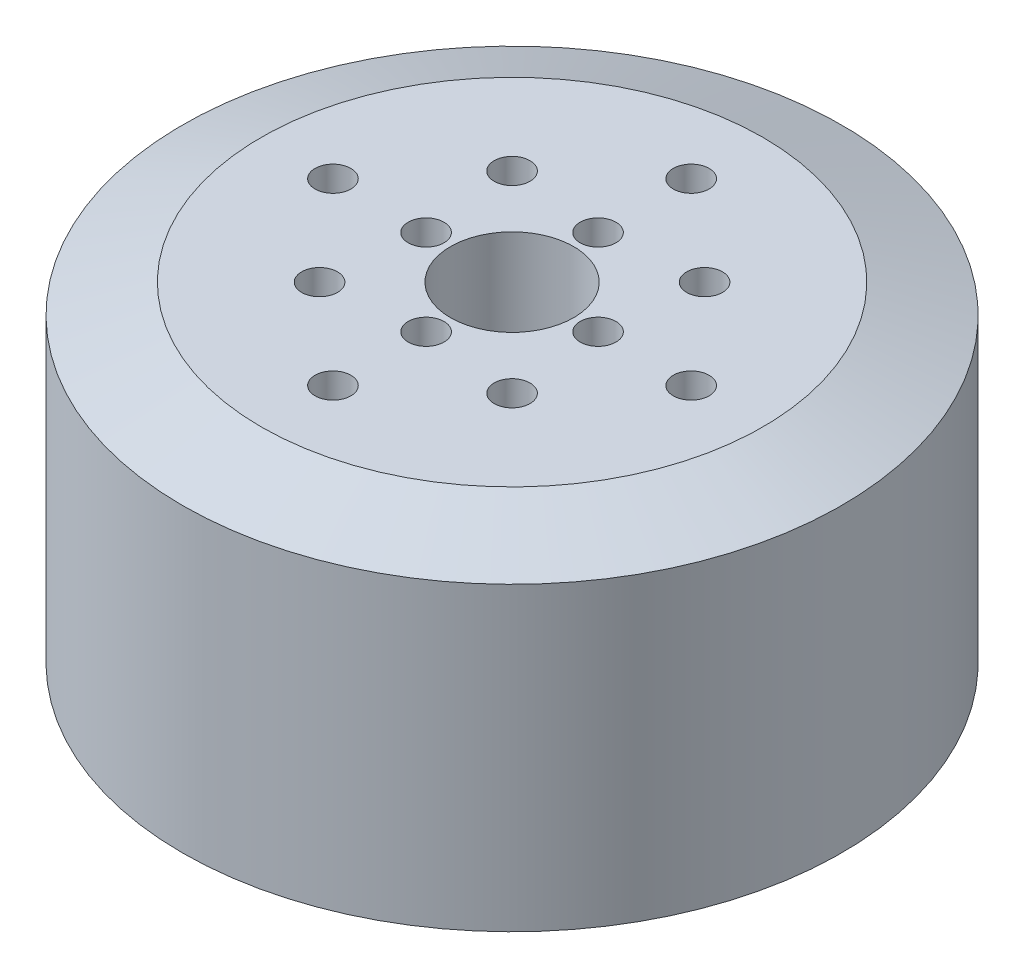
from build123d import *

# Parameters (mm, degrees)
SKETCH_1_R          = 23
EXTRUDE_1_DEPTH     = 23
CHAMFER_1_SIZE      = 2
CHAMFER_1_SIZE2     = 5.494954839
SKETCH_2_R          = 3.5
CUT_EXTRUDE_1_DEPTH = 40.837168574
SKETCH_2_3_R        = 5
SKETCH_2_3_R_2      = 3.5
EXTRUDE_2_DEPTH     = 32
CUT_EXTRUDE_START   = -19
SKETCH_4_R          = 21
SKETCH_4_R_2        = 5
CUT_EXTRUDE_2_DEPTH = 19
M3X0_51_D           = 2.5
M3X0_52_D           = 2.5
M3X0_52_DEPTH       = 7.5
M3X0_52_TIP         = 0.751075774
M3X0_53_D           = 2.5
SKETCH_12_R         = 4.3
CUT_EXTRUDE_3_DEPTH = 25


with BuildPart() as part:
    # Эскиз1 → Бобышка-Вытянуть1 (new body)
    with BuildSketch(Plane(origin=(0, 0, 0), x_dir=(1, 0, 0), z_dir=(0, 1, 0))):
        Circle(SKETCH_1_R)
    extrude(amount=EXTRUDE_1_DEPTH)

    # Фаска1
    chamfer_1_edges = [part.edges().sort_by_distance(p)[0] for p in [
        (-23, 23, 0),
    ]]
    chamfer_1_side = [part.faces().sort_by_distance(p)[0] for p in [
        (-23, 11.5, 0),
    ]]
    chamfer(chamfer_1_edges, length=CHAMFER_1_SIZE, length2=CHAMFER_1_SIZE2, reference=chamfer_1_side[0])

    # Эскиз2 → Вырез-Вытянуть1 (cut, through all)
    with BuildSketch(Plane(origin=(0, 23, 0), x_dir=(1, 0, 0), z_dir=(0, 1, 0))):
        Circle(SKETCH_2_R)
    extrude(amount=-CUT_EXTRUDE_1_DEPTH, mode=Mode.SUBTRACT)

    # Эскиз2<3> → Бобышка-Вытянуть2 (add)
    with BuildSketch(Plane(origin=(0, 23, 0), x_dir=(1, 0, 0), z_dir=(0, 1, 0))):
        Circle(SKETCH_2_3_R)
        Circle(SKETCH_2_3_R_2, mode=Mode.SUBTRACT)
    extrude(amount=-EXTRUDE_2_DEPTH)

    # Эскиз4 → Вырез-Вытянуть2 (cut)
    with BuildSketch(Plane.XZ.offset(CUT_EXTRUDE_START)):
        Circle(SKETCH_4_R)
        Circle(SKETCH_4_R_2, mode=Mode.SUBTRACT)
    extrude(amount=CUT_EXTRUDE_2_DEPTH, mode=Mode.SUBTRACT)

    # Отверстие обработанное метчиком M3x0.51 (through all)
    with Locations(Plane(origin=(0, 23, 0), x_dir=(1, 0, 0), z_dir=(0, 1, 0))):
        with Locations((0, 12.5), (12.5, 0), (0, -12.5), (-12.5, 0)):
            Hole(M3X0_51_D / 2)

    # Отверстие обработанное метчиком M3x0.52
    with Locations(Plane(origin=(0, 23, 0), x_dir=(1, 0, 0), z_dir=(0, 1, 0))):
        with Locations((6, 0), (0, 6), (-6, 0), (0, -6)):
            Hole(M3X0_52_D / 2, depth=M3X0_52_DEPTH)
            with Locations((0, 0, -(M3X0_52_DEPTH + M3X0_52_TIP / 2))):  # 118° drill point
                Cone(0, M3X0_52_D / 2, M3X0_52_TIP, mode=Mode.SUBTRACT)

    # Отверстие обработанное метчиком M3x0.53 (through all)
    with Locations(Plane(origin=(0, 23, 0), x_dir=(1, 0, 0), z_dir=(0, 1, 0))):
        with Locations((-6.717514421, 6.717514421), (6.717514421, 6.717514421), (6.717514421, -6.717514421), (-6.717514421, -6.717514421)):
            Hole(M3X0_53_D / 2)

    # Эскиз12 → Вырез-Вытянуть3 (cut)
    with BuildSketch(Plane(origin=(0, 23, 0), x_dir=(1, 0, 0), z_dir=(0, 1, 0))):
        Circle(SKETCH_12_R)
    extrude(amount=-CUT_EXTRUDE_3_DEPTH, mode=Mode.SUBTRACT)


solid = part.part
